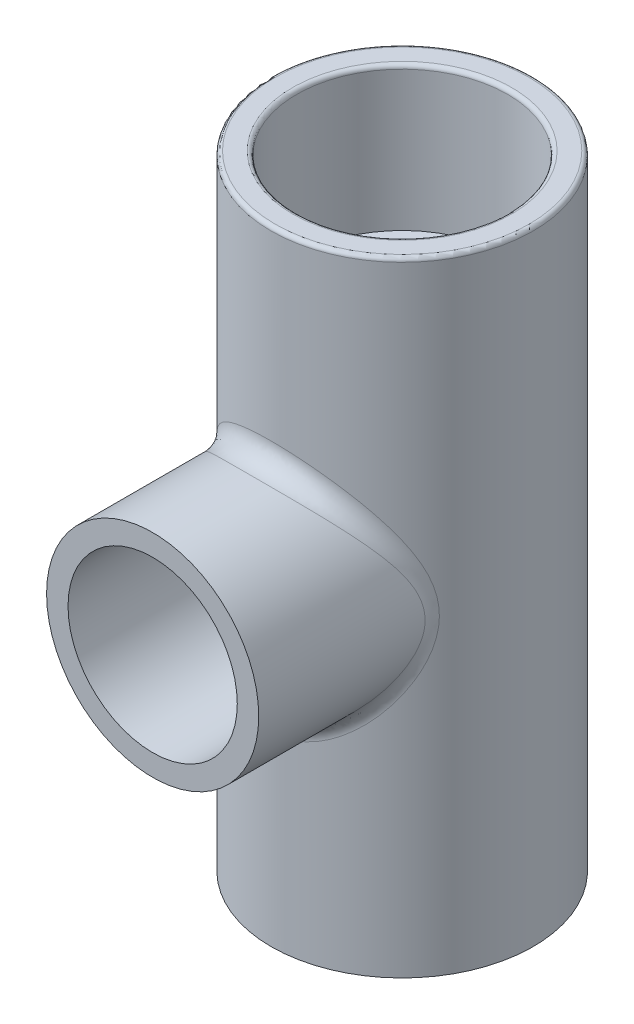
from build123d import *

# Parameters (mm, degrees)
SKETCH3_R                = 0.6565
SKETCH3_R_2              = 0.412
BOSS_EXTRUDE1_DEPTH      = 3.125
SKETCH4_R                = 0.529
CUT_EXTRUDE1_DEPTH       = 0.72
BOSS_EXTRUDE2_REACH      = 5.719
BOSS_EXTRUDE2_END_RADIUS = 0.6565
SKETCH6_R                = 0.5315
FILLET1_R                = 0.1
CUT_EXTRUDE3_START       = 0.56
CUT_EXTRUDE3_OUTLINE_R   = 0.424
CUT_EXTRUDE3_DEPTH       = 0.69
CUT_EXTRUDE4_REACH       = 5.719
CUT_EXTRUDE4_END_RADIUS  = 0.412
SKETCH8_R                = 0.311
FILLET3_R                = 0.02


# Read off the part's stored shape, not the designer's step: Cut-Extrude3
with BuildPart() as part:
    # Sketch3 → Boss-Extrude1 (new body)
    with BuildSketch(Plane(origin=(0, 0, 0), x_dir=(1, 0, 0), z_dir=(0, 1, 0))):
        with Locations(Location((0, 0, 0), (0, 0, 270))):
            Circle(SKETCH3_R)
        with Locations(Location((0, 0, 0), (0, 0, 270))):
            Circle(SKETCH3_R_2, mode=Mode.SUBTRACT)
    extrude(amount=BOSS_EXTRUDE1_DEPTH)

    # Sketch4 → Cut-Extrude1 (cut)
    with BuildSketch(Plane(origin=(0, 3.125, 0), x_dir=(1, 0, 0), z_dir=(0, 1, 0))):
        with Locations(Location((0, 0, 0), (0, 0, 270))):
            Circle(SKETCH4_R)
    cut_extrude1 = extrude(amount=-CUT_EXTRUDE1_DEPTH, mode=Mode.SUBTRACT)

    # Mirror1: Cut-Extrude1 across plane
    add(cut_extrude1.mirror(Plane.ZX.offset(1.5625)), mode=Mode.SUBTRACT)

    # Boss-Extrude2: up to this cylinder (the profile starts outside it)
    boss_extrude2_end = Plane(origin=(0, 1.5625, 0), z_dir=(0, -1, 0)) * Cylinder(BOSS_EXTRUDE2_END_RADIUS, 13.751, mode=Mode.PRIVATE)
    # Sketch6 → Boss-Extrude2 (add, up to the surface)
    with BuildSketch(Plane.XY.offset(1.25), mode=Mode.PRIVATE) as boss_extrude2_sk1:
        with Locations((0, 1.5625)):
            Circle(SKETCH6_R)
    boss_extrude2_tool1 = extrude(boss_extrude2_sk1.sketch, amount=-BOSS_EXTRUDE2_REACH, mode=Mode.PRIVATE) - boss_extrude2_end
    add(boss_extrude2_tool1.solids().sort_by_distance((0, 1.5625, 1.25))[0])

    # Fillet1
    fillet1_edges = [part.edges().sort_by_distance(p)[0] for p in [
        (-0.5315, 1.5625, 0.385356977),
    ]]
    fillet(fillet1_edges, radius=FILLET1_R)

    # Cut-Extrude3 outline → Cut-Extrude3 (cut)
    with BuildSketch(Plane.XY.offset(CUT_EXTRUDE3_START)):
        with Locations((0, 1.5625)):
            Circle(CUT_EXTRUDE3_OUTLINE_R)
    extrude(amount=CUT_EXTRUDE3_DEPTH, mode=Mode.SUBTRACT)

    # Cut-Extrude4: up to this cylinder (the profile starts outside it)
    cut_extrude4_end = Plane(origin=(0, 1.5625, 0), z_dir=(0, -1, 0)) * Cylinder(CUT_EXTRUDE4_END_RADIUS, 13.262, mode=Mode.PRIVATE)
    # Sketch8 → Cut-Extrude4 (cut, up to the surface)
    with BuildSketch(Plane.XY.offset(1.25), mode=Mode.PRIVATE) as cut_extrude4_sk1:
        with Locations((0, 1.5625)):
            Circle(SKETCH8_R)
    cut_extrude4_tool1 = extrude(cut_extrude4_sk1.sketch, amount=-CUT_EXTRUDE4_REACH, mode=Mode.PRIVATE) - cut_extrude4_end
    add(cut_extrude4_tool1.solids().sort_by_distance((0, 1.5625, 1.25))[0], mode=Mode.SUBTRACT)

    # Fillet3
    fillet3_edges = [part.edges().sort_by_distance(p)[0] for p in [
        (0, 3.125, -0.529),
        (0, 3.125, -0.6565),
    ]]
    fillet(fillet3_edges, radius=FILLET3_R)


solid = part.part
